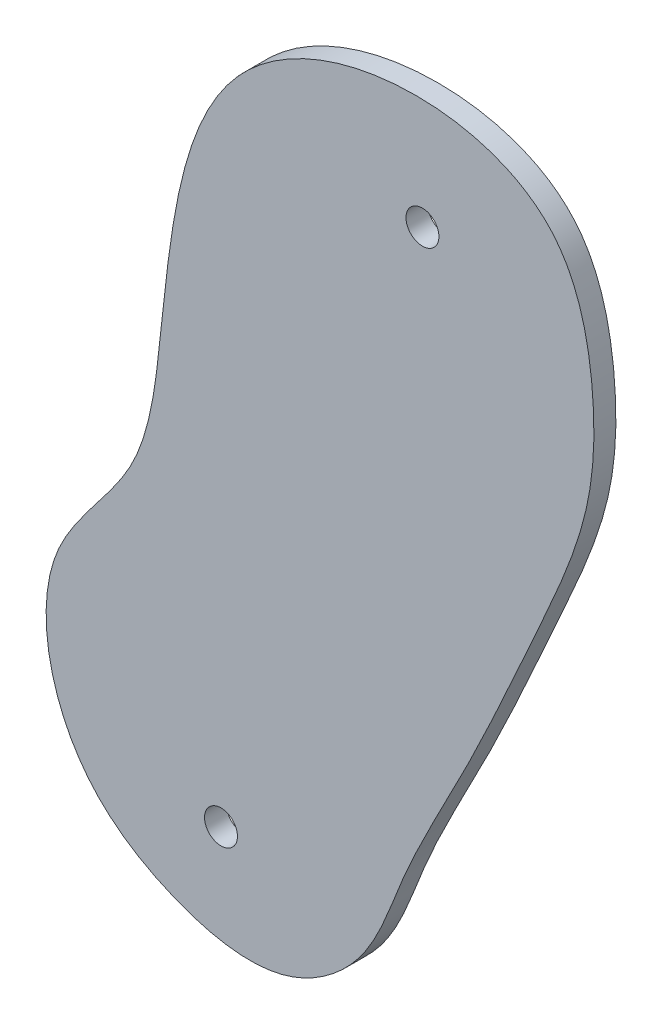
from build123d import *

# Parameters (mm, degrees)
SKETCH1_R           = 1.905
BOSS_EXTRUDE1_DEPTH = 4.292022727
SCALE1_OUTLINE_R    = 1.905
SCALE1_OUTLINE_R_2  = 1.409213181
SCALE1_DEPTH        = 4.292022727
SCALE1_START        = 3.733511251
SCALE1_2_OUTLINE_R  = 1.409213181
SCALE1_2_DEPTH      = 0.558511476
SCALE1_3_OUTLINE_R  = 1.409213181
SCALE1_3_DEPTH      = 0.558511251
SCALE1_START_2      = 0.558511251
SCALE1_4_DEPTH      = 3.175
SKETCH2_R           = 2.38125
CUT_EXTRUDE1_DEPTH  = 603.452030348


# Read off the part's stored shape, not the designer's step: Scale1
with BuildPart() as part:
    # Sketch1 → Boss-Extrude1 (new body)
    with BuildSketch(Plane.XY):
        with BuildLine():
            add(Edge.make_bspline(
                [(517.821302038, 150.609846862), (515.403840728, 144.795140399), (511.539456862, 132.781006119), (493.771716752, 119.262019341), (473.000950298, 123.932413889), (456.70370893, 134.44330542), (447.528324741, 151.368772581), (447.618110077, 174.986787667), (467.256355954, 192.255626849), (471.782574271, 227.829584095), (474.651784003, 267.23993694), (511.392330283, 287.89752885), (548.961443022, 283.049122895), (555.684042706, 253.324742878), (555.006581797, 229.91329948), (543.197565662, 203.926351722), (531.133123022, 176.543708039), (521.081074771, 158.45056038), (517.821302038, 150.609846862)],
                knots=[0, 0, 0, 0, 0.044768286, 0.088853336, 0.144435264, 0.183403678, 0.225322081, 0.276776265, 0.338407841, 0.396981145, 0.529172527, 0.587145359, 0.684949699, 0.740120523, 0.785151712, 0.852540718, 0.939633186, 1, 1, 1, 1], degree=3))
        make_face()
        with Locations((521.680975486, 262.926344183)):
            Circle(SKETCH1_R, mode=Mode.SUBTRACT)
        with Locations((482.312306322, 141.732597933)):
            Circle(SKETCH1_R, mode=Mode.SUBTRACT)
    extrude(amount=BOSS_EXTRUDE1_DEPTH)

    # Scale1 outline → Scale1 (cut)
    # profile 1 of 3: a face of its own
    with BuildSketch(Plane.XY):
        with BuildLine():
            add(Edge.make_bspline(
                [(517.821302038, 150.609846862), (521.081074771, 158.45056038), (531.133123022, 176.543708039), (543.197565662, 203.926351722), (555.006581797, 229.91329948), (555.684042706, 253.324742878), (548.961443022, 283.049122895), (511.392330283, 287.89752885), (474.651784003, 267.23993694), (471.782574271, 227.829584095), (467.256355954, 192.255626849), (447.618110077, 174.986787667), (447.528324741, 151.368772581), (456.70370893, 134.44330542), (473.000950298, 123.932413889), (493.771716752, 119.262019341), (511.539456862, 132.781006119), (515.403840728, 144.795140399), (517.821302038, 150.609846862)],
                knots=[0, 0, 0, 0, 0.060366814, 0.147459282, 0.214848288, 0.259879477, 0.315050301, 0.412854641, 0.470827473, 0.603018855, 0.661592159, 0.723223735, 0.774677919, 0.816596322, 0.855564736, 0.911146664, 0.955231714, 1, 1, 1, 1], degree=3))
        make_face()
        with Locations((482.312306322, 141.732597933)):
            Circle(SCALE1_OUTLINE_R, mode=Mode.SUBTRACT)
        with BuildLine():
            add(Edge.make_bspline(
                [(513.86362032, 164.906081968), (516.275019113, 170.706206292), (523.710966038, 184.09051189), (532.635570546, 204.346670634), (541.371224715, 223.57037106), (541.872372663, 240.888856425), (538.199351156, 257.129342581), (528.516489551, 262.071030376), (523.568963154, 263.180366945)],
                knots=[0, 0, 0, 0, 0.060366814, 0.147459282, 0.214848288, 0.259879477, 0.315050301, 0.361094164, 0.361094164, 0.361094164, 0.361094164], degree=3))
            add(Edge.make_bspline(
                [(519.977371507, 263.778845492), (515.405032064, 264.293202502), (503.733696679, 263.442247729), (481.929208862, 251.182544029), (479.806726881, 222.028954164), (476.458481993, 195.713316659), (461.93119856, 182.938788683), (461.864780356, 165.467493058), (468.652219903, 152.946972629), (480.708013787, 145.171598935), (496.073073034, 141.71670048), (509.216660203, 151.717295944), (512.075316728, 160.604685122), (513.86362032, 164.906081968)],
                knots=[0.371991381, 0.371991381, 0.371991381, 0.371991381, 0.412854641, 0.470827473, 0.603018855, 0.661592159, 0.723223735, 0.774677919, 0.816596322, 0.855564736, 0.911146664, 0.955231714, 1, 1, 1, 1], degree=3))
            ThreePointArc((519.977371507, 263.778845492), (521.994094439, 264.805434793), (523.568963154, 263.180366945))
        make_face(mode=Mode.SUBTRACT)
    # profile 2 of 3: a face of its own
    with BuildSketch(Plane.XY):
        with Locations((487.596037746, 158.339186324)):
            Circle(SCALE1_OUTLINE_R_2)
    # profile 3 of 3: a face of its own
    with BuildSketch(Plane.XY):
        with Locations((516.718792339, 247.991587719)):
            Circle(SCALE1_OUTLINE_R_2)
    extrude(amount=SCALE1_DEPTH, mode=Mode.SUBTRACT)

    # Scale1 2 outline → Scale1 2 (cut)
    with BuildSketch(Plane.XY.offset(SCALE1_START)):
        with BuildLine():
            add(Edge.make_bspline(
                [(519.977371507, 263.778845492), (515.405032064, 264.293202502), (503.733696679, 263.442247729), (481.929208862, 251.182544029), (479.806726881, 222.028954164), (476.458481993, 195.713316659), (461.93119856, 182.938788683), (461.864780356, 165.467493058), (468.652219903, 152.946972629), (480.708013787, 145.171598935), (496.073073034, 141.71670048), (509.216660203, 151.717295944), (514.017483389, 166.642763084), (523.710966038, 184.09051189), (532.635570546, 204.346670634), (541.371224715, 223.57037106), (541.872372663, 240.888856425), (538.199351156, 257.129342581), (528.516489551, 262.071030376), (523.568963154, 263.180366945)],
                knots=[0.371991381, 0.371991381, 0.371991381, 0.371991381, 0.412854641, 0.470827473, 0.603018855, 0.661592159, 0.723223735, 0.774677919, 0.816596322, 0.855564736, 0.911146664, 0.955231714, 1, 1.060366814, 1.147459282, 1.214848288, 1.259879477, 1.315050301, 1.361094164, 1.361094164, 1.361094164, 1.361094164], degree=3))
            ThreePointArc((523.568963154, 263.180366945), (521.367856533, 261.047253573), (519.977371507, 263.778845492))
        make_face()
        with Locations((487.596037746, 158.339186324)):
            Circle(SCALE1_2_OUTLINE_R, mode=Mode.SUBTRACT)
        with Locations((516.718792339, 247.991587719)):
            Circle(SCALE1_2_OUTLINE_R, mode=Mode.SUBTRACT)
    extrude(amount=SCALE1_2_DEPTH, mode=Mode.SUBTRACT)

    # Scale1 3 outline → Scale1 3 (cut)
    with BuildSketch(Plane.XY):
        with BuildLine():
            add(Edge.make_bspline(
                [(519.977371507, 263.778845492), (515.405032064, 264.293202502), (503.733696679, 263.442247729), (481.929208862, 251.182544029), (479.806726881, 222.028954164), (476.458481993, 195.713316659), (461.93119856, 182.938788683), (461.864780356, 165.467493058), (468.652219903, 152.946972629), (480.708013787, 145.171598935), (496.073073034, 141.71670048), (509.216660203, 151.717295944), (514.017483389, 166.642763084), (523.710966038, 184.09051189), (532.635570546, 204.346670634), (541.371224715, 223.57037106), (541.872372663, 240.888856425), (538.199351156, 257.129342581), (528.516489551, 262.071030376), (523.568963154, 263.180366945)],
                knots=[0.371991381, 0.371991381, 0.371991381, 0.371991381, 0.412854641, 0.470827473, 0.603018855, 0.661592159, 0.723223735, 0.774677919, 0.816596322, 0.855564736, 0.911146664, 0.955231714, 1, 1.060366814, 1.147459282, 1.214848288, 1.259879477, 1.315050301, 1.361094164, 1.361094164, 1.361094164, 1.361094164], degree=3))
            ThreePointArc((523.568963154, 263.180366945), (521.367856533, 261.047253573), (519.977371507, 263.778845492))
        make_face()
        with Locations((487.596037746, 158.339186324)):
            Circle(SCALE1_3_OUTLINE_R, mode=Mode.SUBTRACT)
        with Locations((516.718792339, 247.991587719)):
            Circle(SCALE1_3_OUTLINE_R, mode=Mode.SUBTRACT)
    extrude(amount=SCALE1_3_DEPTH, mode=Mode.SUBTRACT)

    # Scale1 4 outline → Scale1 4 (add)
    with BuildSketch(Plane.XY.offset(SCALE1_START_2)):
        with BuildLine():
            ThreePointArc((519.977371507, 263.778845492), (521.367856533, 261.047253573), (523.568963154, 263.180366945))
            add(Edge.make_bspline(
                [(523.568963154, 263.180366945), (522.398030288, 263.442914034), (521.196701025, 263.641679236), (519.977371507, 263.778845492)],
                knots=[0.361094164, 0.361094164, 0.361094164, 0.361094164, 0.371991381, 0.371991381, 0.371991381, 0.371991381], degree=3))
        make_face()
    extrude(amount=SCALE1_4_DEPTH)

    # Sketch2 → Cut-Extrude1 (cut, through all)
    with BuildSketch(Plane.XY.offset(3.733511251)):
        with Locations((516.718792339, 247.991587719)):
            Circle(SKETCH2_R)
        with Locations((487.596037746, 158.339186324)):
            Circle(SKETCH2_R)
    extrude(amount=-CUT_EXTRUDE1_DEPTH, mode=Mode.SUBTRACT)


solid = part.part
